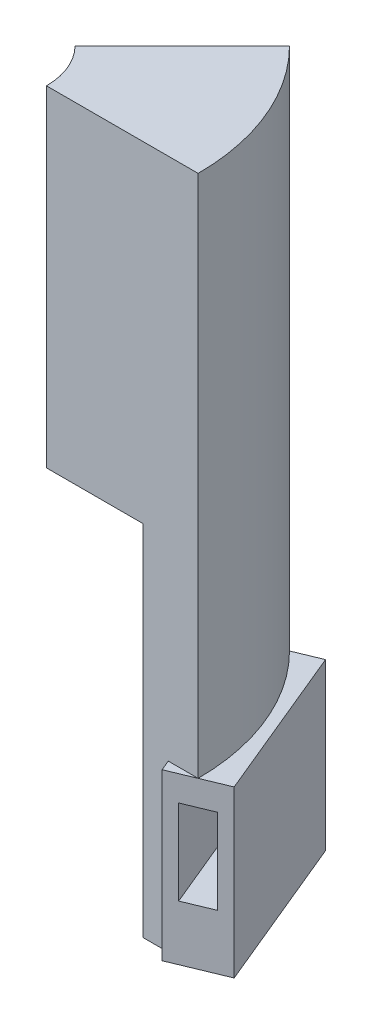
from build123d import *

# Parameters (mm, degrees)
REVOLVE1_ANGLE      = 45
SKETCH2_W           = 30.614674589
SKETCH2_H           = 30
BOSS_EXTRUDE1_DEPTH = 5
SKETCH3_W           = 5.4
SKETCH3_H           = 15.4
CUT_EXTRUDE1_DEPTH  = 82.288411493


with BuildPart() as part:
    # Sketch1 → Revolve1 (revolve)
    with BuildSketch(Plane.XY):
        Polygon((0, 0), (0, 60), (27.5, 60), (27.5, -65), (17.5, -65), (17.5, 0), align=None)
    revolve(axis=Axis((-12.5, 0, 0), (0, 1, 0)), revolution_arc=REVOLVE1_ANGLE)

    # Sketch2 → Boss-Extrude1 (add, symmetric)
    with BuildSketch(Plane(origin=(23.472718241, 0, -9.722718241), x_dir=(0.3826834323650906, 0, 0.9238795325112865), z_dir=(-0.9238795325112865, 0, 0.3826834323650906))):
        with Locations((-4.783542904, -50)):
            Rectangle(SKETCH2_W, SKETCH2_H)
    extrude(amount=BOSS_EXTRUDE1_DEPTH, both=True)

    # Sketch3 → Cut-Extrude1 (cut, through all)
    with BuildSketch(Plane(origin=(4.027281759, 0, 9.722718241), x_dir=(0.9238795325112864, 0, -0.38268343236509067), z_dir=(0.38268343236509067, 0, 0.9238795325112864))):
        with Locations((25.406687144, -47.3)):
            Rectangle(SKETCH3_W, SKETCH3_H)
    extrude(amount=-CUT_EXTRUDE1_DEPTH, mode=Mode.SUBTRACT)


solid = part.part
